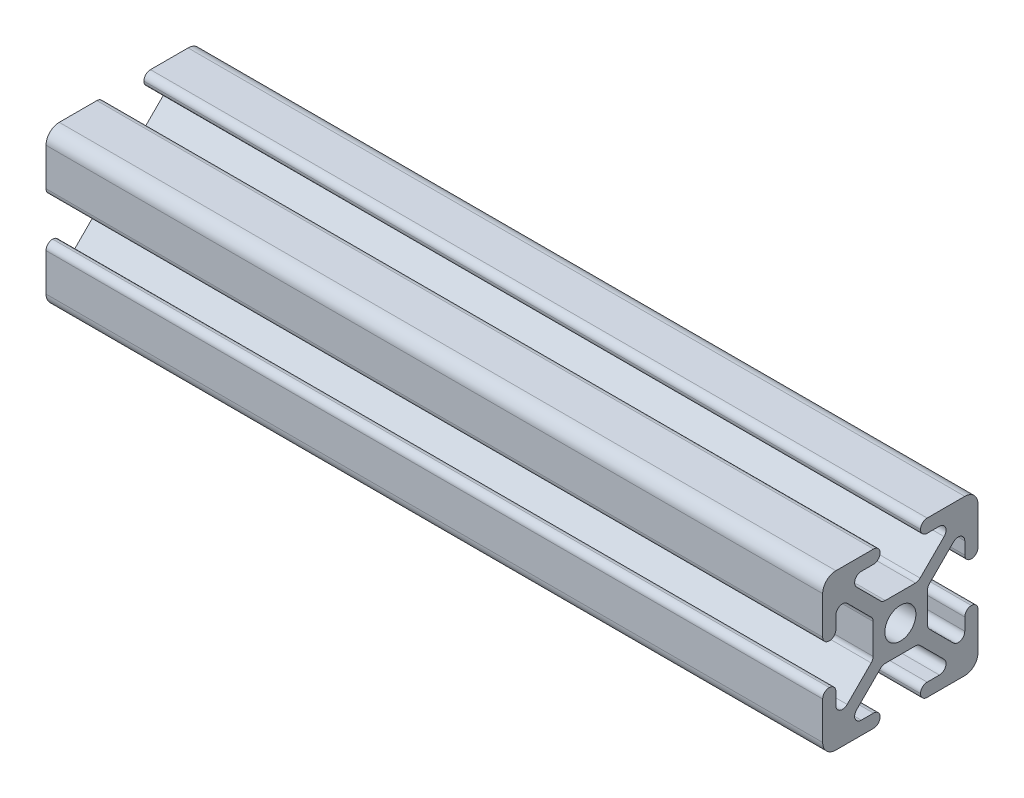
from build123d import *

# Parameters (mm, degrees)
SKETCH1_R           = 2.5
BOSS_EXTRUDE1_DEPTH = 125
FILLET1_R           = 1.065
FILLET2_R           = 2.13


with BuildPart() as part:
    # Sketch1 → Boss-Extrude1 (new body)
    with BuildSketch(Plane.YZ):
        Polygon((-12.5, -3.25), (-12.5, -12.5), (-3.25, -12.5), (-3.25, -10.37), (-8.863862556, -10.37), (-2.873862556, -4.38), (2.873862556, -4.38), (8.863862556, -10.37), (3.25, -10.37), (3.25, -12.5), (12.5, -12.5), (12.5, -3.25), (10.37, -3.25), (10.37, -8.863862556), (4.38, -2.873862556), (4.38, 2.873862556), (10.37, 8.863862556), (10.37, 3.25), (12.5, 3.25), (12.5, 12.5), (3.25, 12.5), (3.25, 10.37), (8.863862556, 10.37), (2.873862556, 4.38), (-2.873862556, 4.38), (-8.863862556, 10.37), (-3.25, 10.37), (-3.25, 12.5), (-12.5, 12.5), (-12.5, 3.25), (-10.37, 3.25), (-10.37, 8.863862556), (-4.38, 2.873862556), (-4.38, -2.873862556), (-10.37, -8.863862556), (-10.37, -3.25), align=None)
        with Locations(Location((0, 0, 0), (0, 0, 270))):
            Circle(SKETCH1_R, mode=Mode.SUBTRACT)
    extrude(amount=BOSS_EXTRUDE1_DEPTH)

    # Fillet1
    fillet1_edges = [part.edges().sort_by_distance(p)[0] for p in [
        (62.5, -10.37, -8.863862556),
        (62.5, 2.873862556, -4.38),
        (62.5, -2.873862556, -4.38),
        (62.5, -4.38, 2.873862556),
        (62.5, -4.38, -2.873862556),
        (62.5, -2.873862556, 4.38),
        (62.5, 2.873862556, 4.38),
        (62.5, 4.38, 2.873862556),
        (62.5, 4.38, -2.873862556),
        (62.5, -8.863862556, -10.37),
        (62.5, 8.863862556, -10.37),
        (62.5, 10.37, -8.863862556),
        (62.5, -10.37, 8.863862556),
        (62.5, -8.863862556, 10.37),
        (62.5, 10.37, 8.863862556),
        (62.5, 8.863862556, 10.37),
        (62.5, 12.5, 3.25),
        (62.5, -3.25, -12.5),
        (62.5, -10.37, 3.25),
        (62.5, 10.37, 3.25),
        (62.5, -10.37, -3.25),
        (62.5, -12.5, -3.25),
        (62.5, -12.5, 3.25),
        (62.5, 3.25, -10.37),
        (62.5, -3.25, -10.37),
        (62.5, 3.25, -12.5),
        (62.5, 10.37, -3.25),
        (62.5, 12.5, -3.25),
        (62.5, 3.25, 12.5),
        (62.5, 3.25, 10.37),
        (62.5, -3.25, 10.37),
        (62.5, -3.25, 12.5),
    ]]
    fillet(fillet1_edges, radius=FILLET1_R - 0.0001)  # a hair under: the kernel refuses the full size

    # Fillet2
    fillet2_edges = [part.edges().sort_by_distance(p)[0] for p in [
        (62.5, -12.5, 12.5),
        (62.5, 12.5, 12.5),
        (62.5, 12.5, -12.5),
        (62.5, -12.5, -12.5),
    ]]
    fillet(fillet2_edges, radius=FILLET2_R)


solid = part.part
